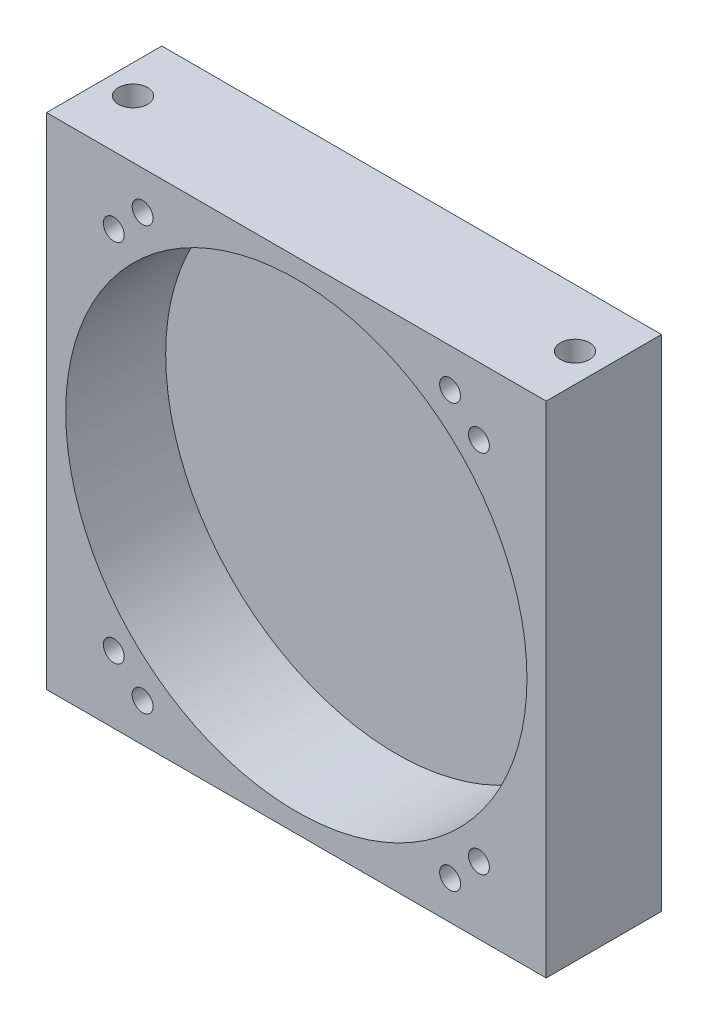
from build123d import *

# Parameters (mm, degrees)
SKETCH1_W                       = 82.55
SKETCH1_H                       = 82.55
BOSS_EXTRUDE1_DEPTH             = 19.05
SKETCH2_R                       = 38.1
CUT_EXTRUDE1_DEPTH              = 16.51
F_10_32_TAPPED_HOLE1_AT_2_COUNT = 2
F_10_32_TAPPED_HOLE1_AT_2_PITCH = 73.025
F_8_32_TAPPED_HOLE1_D           = 3.4544
F_8_32_TAPPED_HOLE1_DEPTH       = 16.002
F_8_32_TAPPED_HOLE1_TIP         = 1.037806461
F_8_32_TAPPED_HOLE2_D           = 3.4544
F_8_32_TAPPED_HOLE2_DEPTH       = 16.002
F_8_32_TAPPED_HOLE2_TIP         = 1.037806461


with BuildPart() as part:
    # Sketch1 → Boss-Extrude1 (new body)
    with BuildSketch(Plane.XY):
        Rectangle(SKETCH1_W, SKETCH1_H)
    extrude(amount=BOSS_EXTRUDE1_DEPTH)

    # Sketch2 → Cut-Extrude1 (cut)
    with BuildSketch(Plane.XY.offset(19.05)):
        Circle(SKETCH2_R)
    extrude(amount=-CUT_EXTRUDE1_DEPTH, mode=Mode.SUBTRACT)

    # Sketch3 → #10-32 Tapped Hole1 (revolve, cut)
    with BuildSketch(Plane(origin=(-36.5125, 41.275, 9.525), x_dir=(0, 0, 1), z_dir=(1, 0, 0))):
        Polygon((0, 0), (0, 20.263317848), (2.0193, 19.05), (2.0193, 18.288), (2.413, 18.288), (2.413, 0), align=None)
    f_10_32_tapped_hole1 = revolve(axis=Axis((-36.5125, 47.625, 9.525), (0, -1, 0)), mode=Mode.SUBTRACT)

    # #10-32 Tapped Hole1 at 2: #10-32 Tapped Hole1 ×2
    with Locations(*[(i * F_10_32_TAPPED_HOLE1_AT_2_PITCH, 0, 0) for i in range(1, F_10_32_TAPPED_HOLE1_AT_2_COUNT)]):
        add(f_10_32_tapped_hole1, mode=Mode.SUBTRACT)

    # Mirror1: #10-32 Tapped Hole1 across plane
    add(f_10_32_tapped_hole1.mirror(Plane.ZX), mode=Mode.SUBTRACT)

    # Mirror1 copy 1 sketch → Mirror1 copy 1 (revolve, cut)
    with BuildSketch(Plane(origin=(36.5125, -41.275, 9.525), x_dir=(0, 0, 1), z_dir=(1, 0, 0))):
        Polygon((0, 0), (0, -20.263317848), (2.0193, -19.05), (2.0193, -18.288), (2.413, -18.288), (2.413, 0), align=None)
    revolve(axis=Axis((36.5125, -47.625, 9.525), (0, -1, 0)), mode=Mode.SUBTRACT)

    # #8-32 Tapped Hole1
    with Locations(Plane.XY.offset(19.05)):
        with Locations((25.4, -34.925), (-25.4, -34.925), (-25.4, 34.925), (25.4, 34.925)):
            Hole(F_8_32_TAPPED_HOLE1_D / 2, depth=F_8_32_TAPPED_HOLE1_DEPTH)
            with Locations((0, 0, -(F_8_32_TAPPED_HOLE1_DEPTH + F_8_32_TAPPED_HOLE1_TIP / 2))):  # 118° drill point
                Cone(0, F_8_32_TAPPED_HOLE1_D / 2, F_8_32_TAPPED_HOLE1_TIP, mode=Mode.SUBTRACT)

    # #8-32 Tapped Hole2
    with Locations(Plane.XY.offset(19.05)):
        with Locations((30.1625, -30.1625), (-30.1625, 30.1625), (-30.1625, -30.1625), (30.1625, 30.1625)):
            Hole(F_8_32_TAPPED_HOLE2_D / 2, depth=F_8_32_TAPPED_HOLE2_DEPTH)
            with Locations((0, 0, -(F_8_32_TAPPED_HOLE2_DEPTH + F_8_32_TAPPED_HOLE2_TIP / 2))):  # 118° drill point
                Cone(0, F_8_32_TAPPED_HOLE2_D / 2, F_8_32_TAPPED_HOLE2_TIP, mode=Mode.SUBTRACT)


solid = part.part
